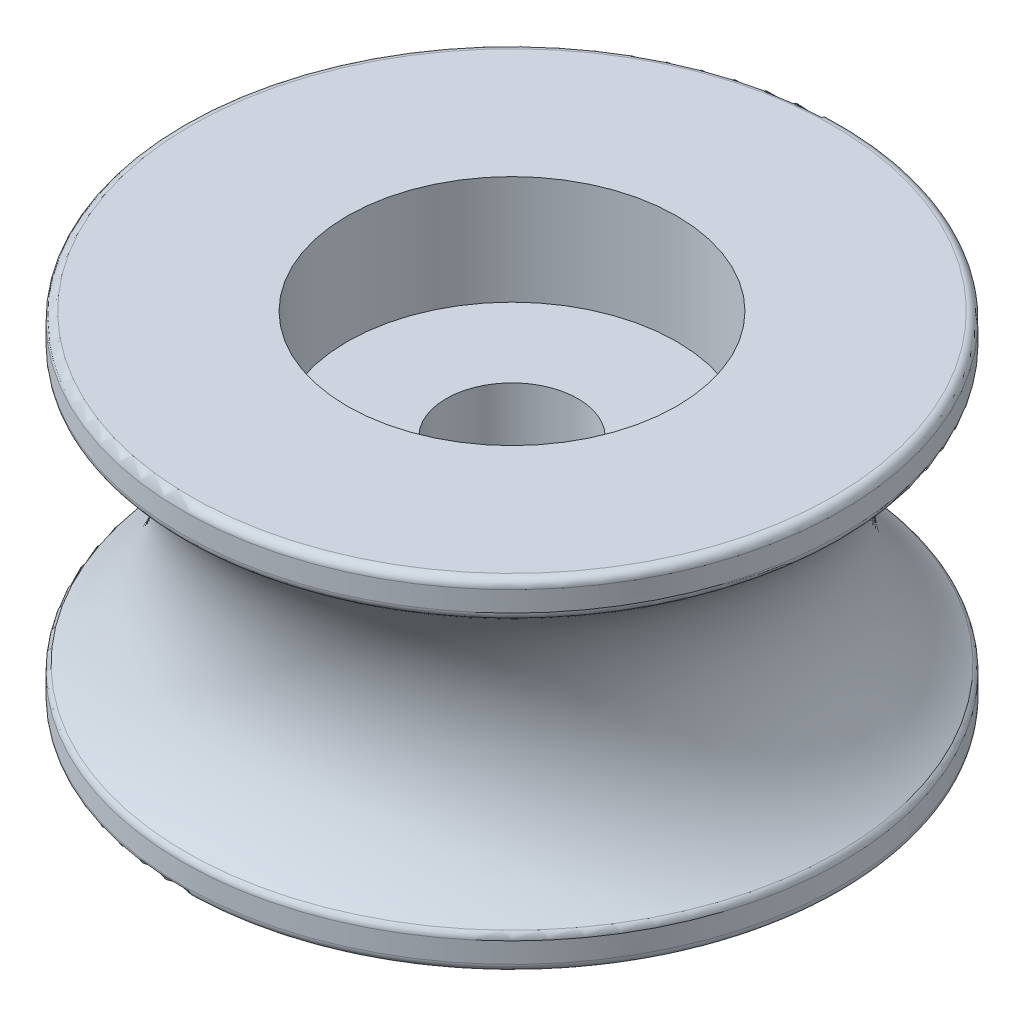
from build123d import *

# Parameters (mm, degrees)
RACCORDO1_R = 0.5


with BuildPart() as part:
    # Schizzo5 → Rivoluzione12 (revolve)
    with BuildSketch(Plane.XY):
        with BuildLine():
            Line((20, 10.35), (20, 8.35))
            ThreePointArc((20, 8.35), (15.502499432, 0), (20, -8.35))
            Line((20, -8.35), (20, -10.35))
            Line((20, -10.35), (10, -10.35))
            Line((10, -10.35), (10, -3.75))
            Line((10, -3.75), (4, -3.75))
            Line((4, -3.75), (4, 3.75))
            Line((4, 3.75), (10, 3.75))
            Line((10, 3.75), (10, 10.35))
            Line((10, 10.35), (20, 10.35))
        make_face()
    revolve(axis=Axis((0, 10.35, 0), (0, -1, 0)))

    # Raccordo1
    raccordo1_edges = [part.edges().sort_by_distance(p)[0] for p in [
        (-20, -10.35, 0),
        (-20, -8.35, 0),
        (-20, 10.35, 0),
        (-20, 8.35, 0),
    ]]
    fillet(raccordo1_edges, radius=RACCORDO1_R)


solid = part.part
